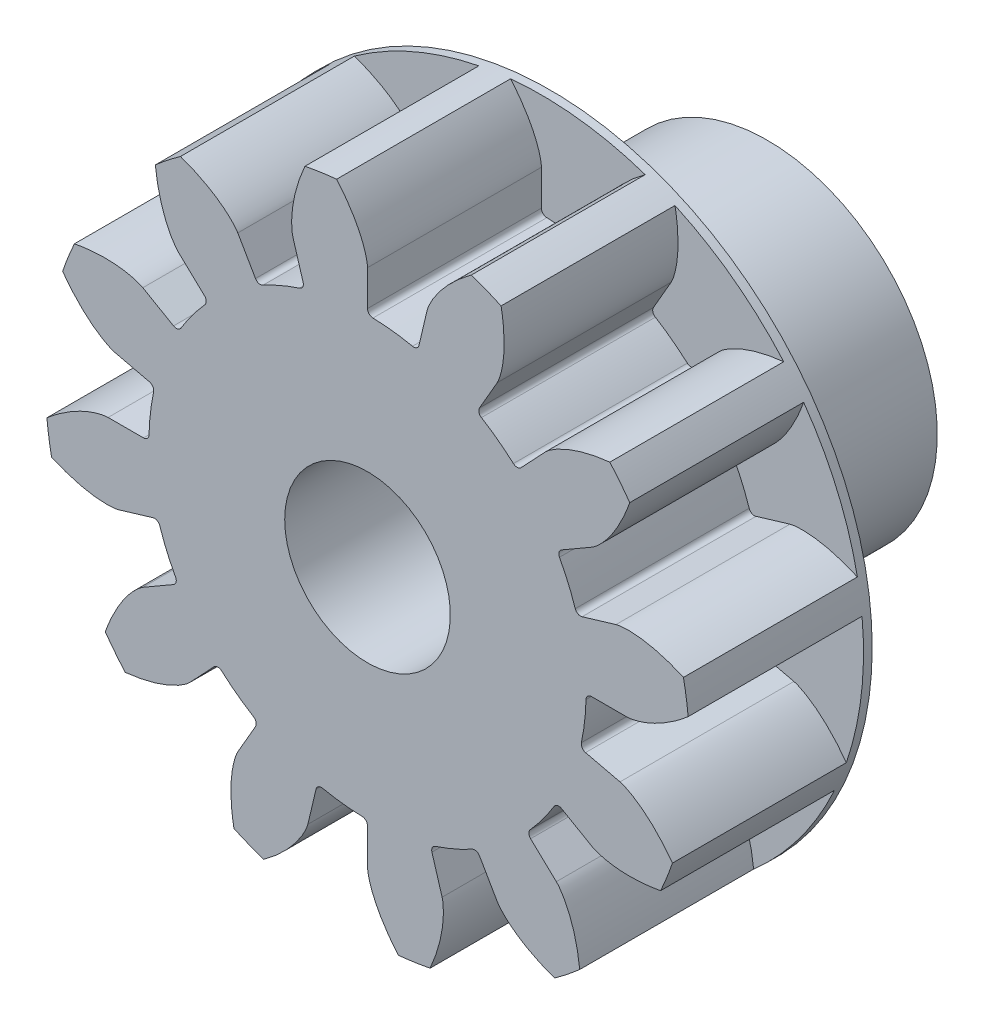
from build123d import *

# Parameters (mm, degrees)
SKETCH2_R                = 14.816666667
BOSS_EXTRUDE1_DEPTH      = 8
CUT_EXTRUDE1_DEPTH       = 8
FILLET1_R                = 0.254
CIRPATTERN3_COUNT        = 12
FILLET1_OF_CIRPATTERN3_R = 0.254
SKETCH3_R                = 3.81
CUT_EXTRUDE2_DEPTH       = 23.338982185
BOSS_EXTRUDE2_START      = 0.4
SKETCH4_R                = 14.816666667
SKETCH4_R_2              = 3.81
BOSS_EXTRUDE2_DEPTH      = 0.4
BOSS_EXTRUDE3_START      = 10
SKETCH5_R                = 7.81
SKETCH5_R_2              = 3.81
BOSS_EXTRUDE3_DEPTH      = 10


# Read off the part's stored shape, not the designer's step: Cut-Extrude1
with BuildPart() as part:
    # Sketch2 → Boss-Extrude1 (new body)
    with BuildSketch(Plane.XY):
        Circle(SKETCH2_R)
    extrude(amount=BOSS_EXTRUDE1_DEPTH)

    # Cut-Extrude1 outline → Cut-Extrude1 (cut)
    with BuildSketch(Plane.XY):
        with BuildLine():
            add(Edge.make_bspline(
                [(14.026638018, -4.773576963), (14.010902603, -4.751887769), (13.942075816, -4.657874164), (13.817486622, -4.494260678), (13.63012428, -4.263185859), (13.395573782, -4.000850782), (13.179506627, -3.78069263), (12.987297125, -3.601718091), (12.822341379, -3.458972402), (12.68291647, -3.345813138), (12.539764434, -3.237159442), (12.392856867, -3.133790969), (12.242134873, -3.036273255), (12.100204962, -2.953076386), (11.968159269, -2.883400046), (11.853696532, -2.829720083), (11.763578292, -2.792119514), (11.691625015, -2.766139389), (11.646926879, -2.752111701), (11.622978074, -2.745859952), (11.614389596, -2.743830974)],
                knots=[0.421528947, 0.421528947, 0.421528947, 0.421528947, 0.421528947, 0.43785898, 0.492591256, 0.547323565, 0.602055884, 0.652783571, 0.680149903, 0.707515961, 0.734882063, 0.762248421, 0.789614741, 0.816980391, 0.844236067, 0.862480777, 0.880559096, 0.894007228, 0.903714168, 0.909090916, 0.909090916, 0.909090916, 0.909090916, 0.909090916], degree=4))
            ThreePointArc((14.026638018, -4.773576963), (14.717099908, -1.714812357), (14.748391735, 1.420757664))
            add(Edge.make_bspline(
                [(11.934096284, 0), (11.942921175, 0), (11.96766578, 0.000578073), (12.014391661, 0.003953185), (12.090390584, 0.012694162), (12.18673956, 0.028567876), (12.310477757, 0.054493057), (12.455005686, 0.091943491), (12.612261619, 0.140279717), (12.78136668, 0.200531706), (12.948104678, 0.267354712), (13.112402909, 0.340184807), (13.274109757, 0.418256692), (13.46746586, 0.519252472), (13.695675174, 0.6492405), (13.956571751, 0.81382362), (14.245153634, 1.015204169), (14.48062429, 1.19701118), (14.63949306, 1.327596609), (14.728091184, 1.403267321), (14.748391735, 1.420757664)],
                knots=[0, 0, 0, 0, 0, 0.005376748, 0.015083688, 0.02853182, 0.046610139, 0.064854849, 0.092110525, 0.119476175, 0.146842495, 0.174208853, 0.201574955, 0.228941013, 0.256307345, 0.307035032, 0.361767351, 0.41649966, 0.471231936, 0.487561969, 0.487561969, 0.487561969, 0.487561969, 0.487561969], degree=4))
            Line((11.934096284, 0), (10.054166667, 0))
            ThreePointArc((10.054166667, 0), (9.986603509, -1.163622671), (9.784822072, -2.311606448))
            Line((9.784822072, -2.311606448), (11.614389596, -2.743830974))
        make_face()
    cut_extrude1 = extrude(amount=CUT_EXTRUDE1_DEPTH, mode=Mode.SUBTRACT)

    # Fillet1
    fillet1_edges = [part.edges().sort_by_distance(p)[0] for p in [
        (9.784822072, -2.311606448, 4),
        (10.054166667, 0, 4),
    ]]
    fillet(fillet1_edges, radius=FILLET1_R)

    # CirPattern3: Cut-Extrude1 ×12 about axis
    cirpattern3_axis = Axis((0, 0, 55), (0, 0, -1))
    for i in range(1, CIRPATTERN3_COUNT):
        add(cut_extrude1.rotate(cirpattern3_axis, i * 360 / CIRPATTERN3_COUNT), mode=Mode.SUBTRACT)

    # Fillet1 of CirPattern3
    fillet1_of_cirpattern3_edges = [part.edges().sort_by_distance(p)[0] for p in [
        (7.318101262, -6.894320944, 4),
        (8.707163748, -5.027083333, 4),
        (2.890501128, -9.62970771, 4),
        (5.027083334, -8.707163748, 4),
        (-2.311606448, -9.784822072, 4),
        (0, -10.054166667, 4),
        (-6.894320944, -7.318101262, 4),
        (-5.027083333, -8.707163748, 4),
        (-9.62970771, -2.890501128, 4),
        (-8.707163748, -5.027083333, 4),
        (-9.784822072, 2.311606448, 4),
        (-10.054166667, 0, 4),
        (-7.318101262, 6.894320944, 4),
        (-8.707163748, 5.027083334, 4),
        (-2.890501128, 9.62970771, 4),
        (-5.027083334, 8.707163748, 4),
        (2.311606448, 9.784822072, 4),
        (0, 10.054166667, 4),
        (6.894320944, 7.318101262, 4),
        (5.027083334, 8.707163748, 4),
        (9.62970771, 2.890501128, 4),
        (8.707163748, 5.027083334, 4),
    ]]
    fillet(fillet1_of_cirpattern3_edges, radius=FILLET1_OF_CIRPATTERN3_R)

    # Sketch3 → Cut-Extrude2 (cut, through all)
    with BuildSketch(Plane(origin=(0, 0, 0), x_dir=(-1, 0, 0), z_dir=(0, 0, -1))):
        Circle(SKETCH3_R)
    extrude(amount=-CUT_EXTRUDE2_DEPTH, mode=Mode.SUBTRACT)

    # Sketch4 → Boss-Extrude2 (add)
    with BuildSketch(Plane(origin=(0, 0, 0), x_dir=(-1, 0, 0), z_dir=(0, 0, -1)).offset(BOSS_EXTRUDE2_START)):
        Circle(SKETCH4_R)
        Circle(SKETCH4_R_2, mode=Mode.SUBTRACT)
    extrude(amount=-BOSS_EXTRUDE2_DEPTH)

    # Sketch5 → Boss-Extrude3 (add)
    with BuildSketch(Plane(origin=(0, 0, -0.4), x_dir=(-1, 0, 0), z_dir=(0, 0, -1)).offset(BOSS_EXTRUDE3_START)):
        Circle(SKETCH5_R)
        Circle(SKETCH5_R_2, mode=Mode.SUBTRACT)
    extrude(amount=-BOSS_EXTRUDE3_DEPTH)


solid = part.part
